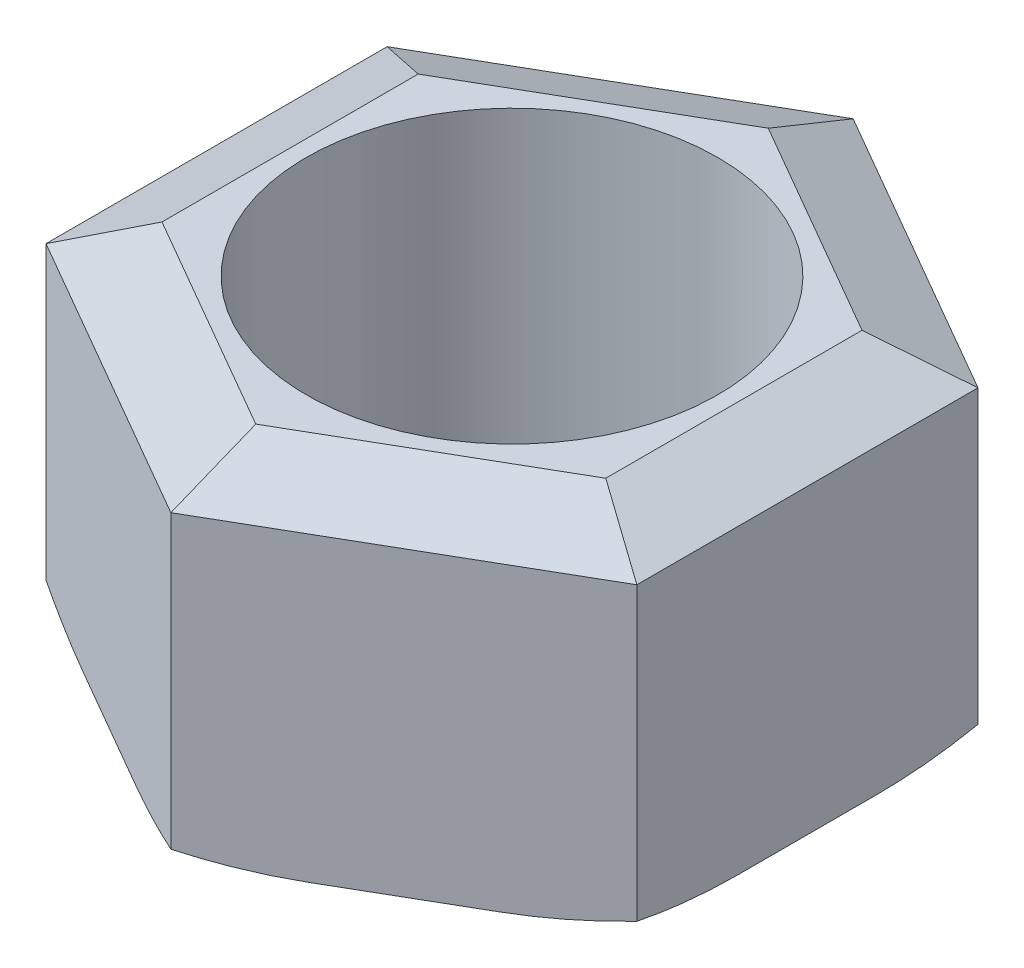
from build123d import *
from OCP.BRepFilletAPI import BRepFilletAPI_MakeChamfer

# Parameters (mm, degrees)
SKETCH_1_R      = 6
EXTRUDE_1_DEPTH = 10.8
CHAMFER_1_SIZE  = 1
CHAMFER_1_SIZE2 = 2.144506921
CHAMFER_2_SIZE  = 1
CHAMFER_2_SIZE2 = 2.144506921
FILLET_2_R      = 12


with BuildPart() as part:
    # Эскиз1 → Бобышка-Вытянуть1 (new body)
    with BuildSketch(Plane(origin=(0, 0, 0), x_dir=(1, 0, 0), z_dir=(0, 1, 0))):
        Polygon((0, 9.95), (-8.616952768, 4.975), (-8.616952768, -4.975), (0, -9.95), (8.616952768, -4.975), (8.616952768, 4.975), align=None)
        Circle(SKETCH_1_R, mode=Mode.SUBTRACT)
    extrude(amount=EXTRUDE_1_DEPTH)

    # Фаска1: one chamfer whose edges measure the first distance from different faces: ONE call of the kernel's chamfer builder (chamfer() names one face for all edges)
    chamfer_1_edges_1 = [part.edges().sort_by_distance(p)[0] for p in [
        (8.616952768, 10.8, 0),
    ]]
    chamfer_1_side_1 = [part.faces().sort_by_distance(p)[0] for p in [
        (8.616952768, 5.4, 0),
    ]]
    chamfer_1_edges_2 = [part.edges().sort_by_distance(p)[0] for p in [
        (4.308476384, 10.8, -7.4625),
    ]]
    chamfer_1_side_2 = [part.faces().sort_by_distance(p)[0] for p in [
        (4.308476384, 5.4, -7.4625),
    ]]
    chamfer_1_edges_3 = [part.edges().sort_by_distance(p)[0] for p in [
        (-4.308476384, 10.8, -7.4625),
    ]]
    chamfer_1_side_3 = [part.faces().sort_by_distance(p)[0] for p in [
        (-4.308476384, 5.4, -7.4625),
    ]]
    chamfer_1_edges_4 = [part.edges().sort_by_distance(p)[0] for p in [
        (-8.616952768, 10.8, 0),
    ]]
    chamfer_1_side_4 = [part.faces().sort_by_distance(p)[0] for p in [
        (-8.616952768, 5.4, 0),
    ]]
    chamfer_1_edges_5 = [part.edges().sort_by_distance(p)[0] for p in [
        (-4.308476384, 10.8, 7.4625),
    ]]
    chamfer_1_side_5 = [part.faces().sort_by_distance(p)[0] for p in [
        (-4.308476384, 5.4, 7.4625),
    ]]
    chamfer_1_edges_6 = [part.edges().sort_by_distance(p)[0] for p in [
        (4.308476384, 10.8, 7.4625),
    ]]
    chamfer_1_side_6 = [part.faces().sort_by_distance(p)[0] for p in [
        (4.308476384, 5.4, 7.4625),
    ]]
    chamfer_1 = BRepFilletAPI_MakeChamfer(part.part.solid().wrapped)
    for e in chamfer_1_edges_1:
        chamfer_1.Add(CHAMFER_1_SIZE, CHAMFER_1_SIZE2, e.wrapped, chamfer_1_side_1[0].wrapped)  # the first distance lies on this face
    for e in chamfer_1_edges_2:
        chamfer_1.Add(CHAMFER_1_SIZE, CHAMFER_1_SIZE2, e.wrapped, chamfer_1_side_2[0].wrapped)  # the first distance lies on this face
    for e in chamfer_1_edges_3:
        chamfer_1.Add(CHAMFER_1_SIZE, CHAMFER_1_SIZE2, e.wrapped, chamfer_1_side_3[0].wrapped)  # the first distance lies on this face
    for e in chamfer_1_edges_4:
        chamfer_1.Add(CHAMFER_1_SIZE, CHAMFER_1_SIZE2, e.wrapped, chamfer_1_side_4[0].wrapped)  # the first distance lies on this face
    for e in chamfer_1_edges_5:
        chamfer_1.Add(CHAMFER_1_SIZE, CHAMFER_1_SIZE2, e.wrapped, chamfer_1_side_5[0].wrapped)  # the first distance lies on this face
    for e in chamfer_1_edges_6:
        chamfer_1.Add(CHAMFER_1_SIZE, CHAMFER_1_SIZE2, e.wrapped, chamfer_1_side_6[0].wrapped)  # the first distance lies on this face
    add(Compound.cast(chamfer_1.Shape()), mode=Mode.REPLACE)

    # Фаска2: one chamfer whose edges measure the first distance from different faces: ONE call of the kernel's chamfer builder (chamfer() names one face for all edges)
    chamfer_2_edges_1 = [part.edges().sort_by_distance(p)[0] for p in [
        (-4.308476384, 0, -7.4625),
    ]]
    chamfer_2_side_1 = [part.faces().sort_by_distance(p)[0] for p in [
        (-4.308476384, 4.9, -7.4625),
    ]]
    chamfer_2_edges_2 = [part.edges().sort_by_distance(p)[0] for p in [
        (4.308476384, 0, -7.4625),
    ]]
    chamfer_2_side_2 = [part.faces().sort_by_distance(p)[0] for p in [
        (4.308476384, 4.9, -7.4625),
    ]]
    chamfer_2_edges_3 = [part.edges().sort_by_distance(p)[0] for p in [
        (8.616952768, 0, 0),
    ]]
    chamfer_2_side_3 = [part.faces().sort_by_distance(p)[0] for p in [
        (8.616952768, 4.9, 0),
    ]]
    chamfer_2_edges_4 = [part.edges().sort_by_distance(p)[0] for p in [
        (4.308476384, 0, 7.4625),
    ]]
    chamfer_2_side_4 = [part.faces().sort_by_distance(p)[0] for p in [
        (4.308476384, 4.9, 7.4625),
    ]]
    chamfer_2_edges_5 = [part.edges().sort_by_distance(p)[0] for p in [
        (-4.308476384, 0, 7.4625),
    ]]
    chamfer_2_side_5 = [part.faces().sort_by_distance(p)[0] for p in [
        (-4.308476384, 4.9, 7.4625),
    ]]
    chamfer_2_edges_6 = [part.edges().sort_by_distance(p)[0] for p in [
        (-8.616952768, 0, 0),
    ]]
    chamfer_2_side_6 = [part.faces().sort_by_distance(p)[0] for p in [
        (-8.616952768, 4.9, 0),
    ]]
    chamfer_2 = BRepFilletAPI_MakeChamfer(part.part.solid().wrapped)
    for e in chamfer_2_edges_1:
        chamfer_2.Add(CHAMFER_2_SIZE, CHAMFER_2_SIZE2, e.wrapped, chamfer_2_side_1[0].wrapped)  # the first distance lies on this face
    for e in chamfer_2_edges_2:
        chamfer_2.Add(CHAMFER_2_SIZE, CHAMFER_2_SIZE2, e.wrapped, chamfer_2_side_2[0].wrapped)  # the first distance lies on this face
    for e in chamfer_2_edges_3:
        chamfer_2.Add(CHAMFER_2_SIZE, CHAMFER_2_SIZE2, e.wrapped, chamfer_2_side_3[0].wrapped)  # the first distance lies on this face
    for e in chamfer_2_edges_4:
        chamfer_2.Add(CHAMFER_2_SIZE, CHAMFER_2_SIZE2, e.wrapped, chamfer_2_side_4[0].wrapped)  # the first distance lies on this face
    for e in chamfer_2_edges_5:
        chamfer_2.Add(CHAMFER_2_SIZE, CHAMFER_2_SIZE2, e.wrapped, chamfer_2_side_5[0].wrapped)  # the first distance lies on this face
    for e in chamfer_2_edges_6:
        chamfer_2.Add(CHAMFER_2_SIZE, CHAMFER_2_SIZE2, e.wrapped, chamfer_2_side_6[0].wrapped)  # the first distance lies on this face
    add(Compound.cast(chamfer_2.Shape()), mode=Mode.REPLACE)

    # Скругление2
    fillet_2_edges = [part.edges().sort_by_distance(p)[0] for p in [
        (0, 0.5, -8.711868352),
        (-7.544699307, 0.5, -4.355934176),
        (-7.544699307, 0.5, 4.355934176),
        (0, 0.5, 8.711868352),
        (7.544699307, 0.5, 4.355934176),
        (7.544699307, 0.5, -4.355934176),
    ]]
    fillet(fillet_2_edges, radius=FILLET_2_R)


solid = part.part
